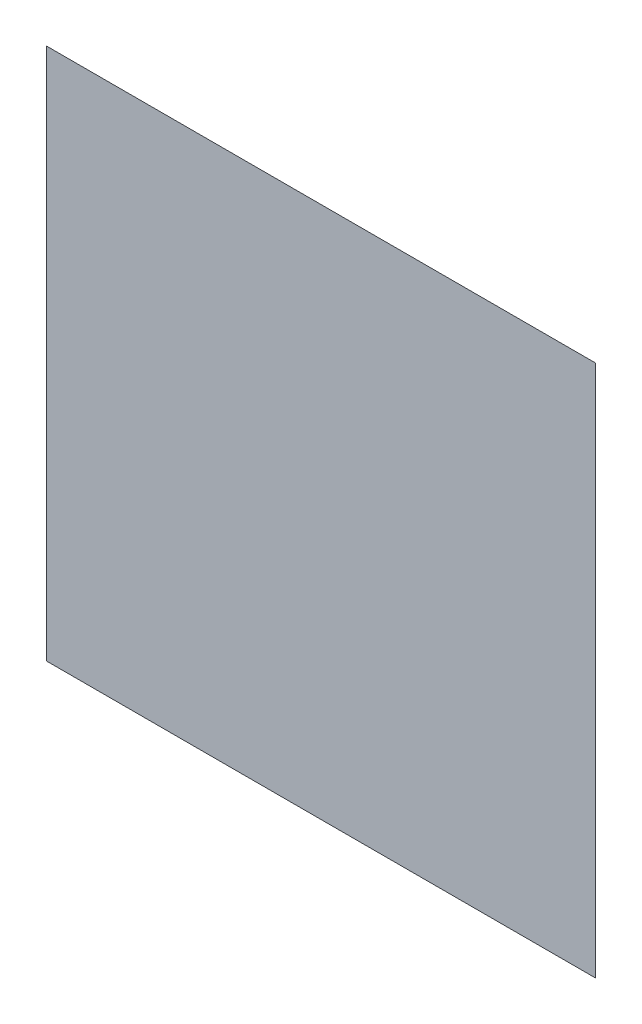
from build123d import *


with BuildPart() as part:
    # 草图2 → 放样1 section 0
    with BuildSketch(Plane.XY.offset(100)):
        with BuildLine():
            Line((-122.495603667, 226.396179637), (212.504396333, 226.396179637))
            Line((212.504396333, 226.396179637), (212.504396333, -98.603820363))
            Line((212.504396333, -98.603820363), (-122.495603667, -98.603820363))
            Line((-122.495603667, -98.603820363), (-122.495603667, 226.396179637))
        make_face()
    # 草图1 → 放样1 section 1
    with BuildSketch(Plane.XY):
        with BuildLine():
            Line((-22.495603667, 126.396179637), (112.504396333, 126.396179637))
            Line((112.504396333, 126.396179637), (112.504396333, 1.396179637))
            Line((112.504396333, 1.396179637), (-22.495603667, 1.396179637))
            Line((-22.495603667, 1.396179637), (-22.495603667, 126.396179637))
        make_face()
    loft()


solid = part.part
